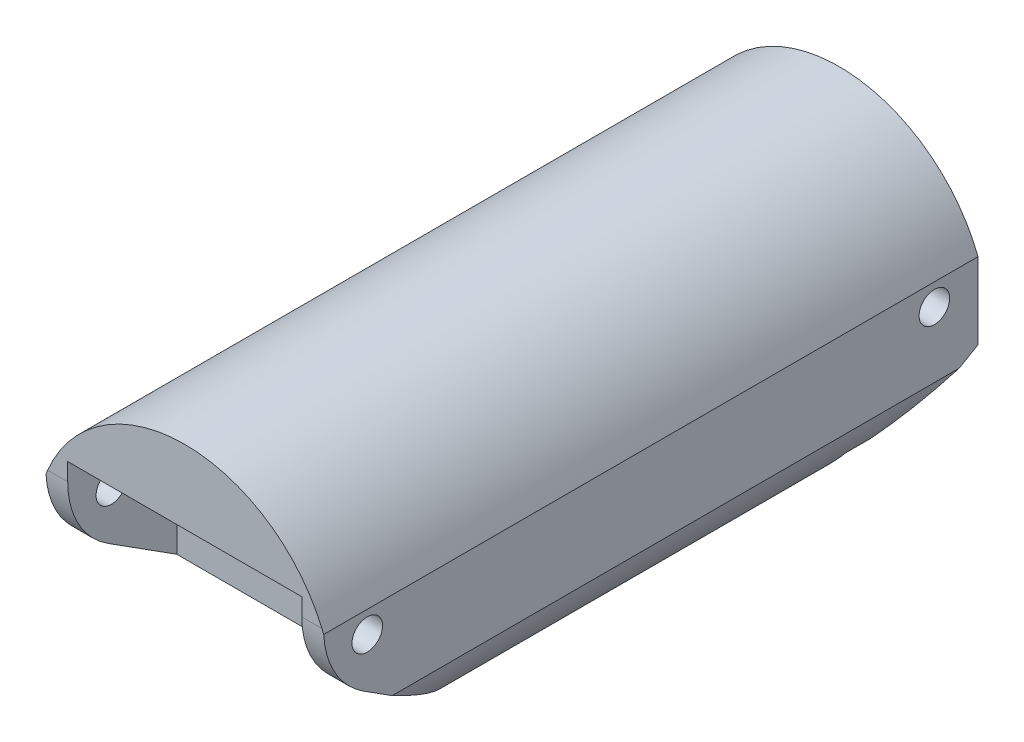
from build123d import *

# Parameters (mm, degrees)
BOSS_EXTRUDE1_DEPTH = 19.05
CUT_EXTRUDE1_DEPTH  = 28.152681872
CUT_EXTRUDE2_DEPTH  = 43.73143612
SKETCH10_R          = 0.889
CUT_EXTRUDE7_DEPTH  = 28.152681872
SKETCH17_W          = 13.630142158
SKETCH17_H          = 6.35
CUT_EXTRUDE14_DEPTH = 12.065
CUT_EXTRUDE15_DEPTH = 17.78
CUT_EXTRUDE16_DEPTH = 17.78
FILLET1_R           = 2.54
FILLET2_R           = 5.08
SKETCH20_W          = 0.284935898
SKETCH20_H          = 2.320192307
CUT_EXTRUDE17_DEPTH = 1
CUT_EXTRUDE18_DEPTH = 17.78


with BuildPart() as part:
    # Sketch1 → Boss-Extrude1 (new, symmetric)
    with BuildSketch(Plane.XY):
        with BuildLine():
            Line((0, 0), (0, 5.08))
            ThreePointArc((0, 5.08), (8.085071079, 10.625071079), (16.170142158, 5.08))
            Line((16.170142158, 5.08), (16.170142158, 0))
            ThreePointArc((16.170142158, 0), (8.085071079, -5.545071079), (0, 0))
        make_face()
    extrude(amount=BOSS_EXTRUDE1_DEPTH, both=True)

    # Sketch2 → Cut-Extrude1 (cut, through all)
    with BuildSketch(Plane(origin=(0, 0, 0), x_dir=(0, 0, -1), z_dir=(1, 0, 0))):
        Polygon((-19.05, -5.545071079), (-19.05, 2.54), (-6.35, -5.545071079), align=None)
        Polygon((19.05, 0.635), (19.05, -5.545071079), (8.345802897, -5.545071079), align=None)
    extrude(amount=CUT_EXTRUDE1_DEPTH, mode=Mode.SUBTRACT)

    # Sketch3 → Cut-Extrude2 (cut, through all)
    with BuildSketch(Plane.XY.offset(19.05)):
        with BuildLine():
            ThreePointArc((5.441540811, -3.786556728), (8.085071079, -4.275071079), (10.728601347, -3.786556728))
            ThreePointArc((10.728601347, -3.786556728), (8.085071079, -2.370071079), (5.441540811, -3.786556728))
        make_face()
    extrude(amount=-CUT_EXTRUDE2_DEPTH, mode=Mode.SUBTRACT)

    # Sketch10 → Cut-Extrude7 (cut, through all)
    with BuildSketch(Plane.ZY):
        with Locations((-16.51, 3.81)):
            Circle(SKETCH10_R)
    cut_extrude7 = extrude(amount=-CUT_EXTRUDE7_DEPTH, mode=Mode.SUBTRACT)

    # Mirror4: Cut-Extrude7 across plane
    add(cut_extrude7.mirror(Plane(origin=(0, 0, 0), x_dir=(1, 0, 0), z_dir=(0, 0, -1))), mode=Mode.SUBTRACT)

    # Sketch17 → Cut-Extrude14 (cut)
    with BuildSketch(Plane(origin=(0, -5.715, 0), x_dir=(1, 0, 0), z_dir=(0, 1, 0))):
        with Locations((8.085071079, -15.875)):
            Rectangle(SKETCH17_W, SKETCH17_H)
        with Locations((8.085071079, 15.875)):
            Rectangle(SKETCH17_W, SKETCH17_H)
    extrude(amount=CUT_EXTRUDE14_DEPTH, mode=Mode.SUBTRACT)

    # Sketch18 → Cut-Extrude15 (cut)
    with BuildSketch(Plane.XY.offset(12.7)):
        with BuildLine():
            Line((10.117071079, 7.4676), (10.752071079, 7.4676))
            ThreePointArc((10.752071079, 7.4676), (11.133071079, 7.8486), (10.752071079, 8.2296))
            Line((10.752071079, 8.2296), (10.117071079, 8.2296))
            ThreePointArc((10.117071079, 8.2296), (9.736071079, 7.8486), (10.117071079, 7.4676))
        make_face()
    extrude(amount=-CUT_EXTRUDE15_DEPTH, mode=Mode.SUBTRACT)

    # Sketch19 → Cut-Extrude16 (cut)
    with BuildSketch(Plane(origin=(0, 0, -12.7), x_dir=(-1, 0, 0), z_dir=(0, 0, -1))):
        with BuildLine():
            Line((-6.053071079, 5.3086), (-5.418071079, 5.3086))
            ThreePointArc((-5.418071079, 5.3086), (-5.037071079, 5.6896), (-5.418071079, 6.0706))
            Line((-5.418071079, 6.0706), (-6.053071079, 6.0706))
            ThreePointArc((-6.053071079, 6.0706), (-6.434071079, 5.6896), (-6.053071079, 5.3086))
        make_face()
    extrude(amount=-CUT_EXTRUDE16_DEPTH, mode=Mode.SUBTRACT)

    # Fillet1
    # the kernel refuses this fillet: 2.54 mm, written as the material it takes off along each edge
    with BuildSketch(Plane(origin=(6.358213123, -3.031174209, -12.7), x_dir=(0, 1, 0), z_dir=(1, 0, 0))) as fillet1_piece_1_section:
        with BuildLine():
            CenterArc((FILLET1_R * 0.57735026919, FILLET1_R), FILLET1_R, 210, 60)
            Line((-FILLET1_R * 0.288675134595, FILLET1_R * 0.5), (0, 0))
            Line((0, 0), (FILLET1_R * 0.57735026919, 0))
        make_face()
    fillet1_piece_1 = extrude(amount=11.496741726, mode=Mode.PRIVATE)
    fillet1_piece_1 = split(fillet1_piece_1, bisect_by=Plane(origin=(14.900142158, -2.770915154, -12.481593897), z_dir=(-1, 0, 0)), keep=Keep.TOP, mode=Mode.PRIVATE)
    add(fillet1_piece_1, mode=Mode.SUBTRACT)
    with BuildSketch(Plane(origin=(-1.684812691, -3.031174209, -12.7), x_dir=(0, 1, 0), z_dir=(1, 0, 0))) as fillet1_piece_2_section:
        with BuildLine():
            CenterArc((FILLET1_R * 0.57735026919, FILLET1_R), FILLET1_R, 210, 60)
            Line((-FILLET1_R * 0.288675134595, FILLET1_R * 0.5), (0, 0))
            Line((0, 0), (FILLET1_R * 0.57735026919, 0))
        make_face()
    fillet1_piece_2 = extrude(amount=11.496741726, mode=Mode.PRIVATE)
    fillet1_piece_2 = split(fillet1_piece_2, bisect_by=Plane(origin=(1.27, -2.770915061, -12.481593186), z_dir=(1, 0, 0)), keep=Keep.TOP, mode=Mode.PRIVATE)
    add(fillet1_piece_2, mode=Mode.SUBTRACT)

    # Fillet2
    fillet2_edges = [part.edges().sort_by_distance(p)[0] for p in [
        (0.635, 2.54, 19.05),
        (15.535142158, 2.54, 19.05),
    ]]
    fillet(fillet2_edges, radius=FILLET2_R)

    # Sketch20 → Cut-Extrude17 (cut)
    # profile 1 of 6: a face of its own
    with BuildSketch(Plane.ZY):
        with BuildLine():
            Line((-6.061862576, 4.037521848), (-5.426480965, 4.037521848))
            add(Edge.make_bspline(
                [(-5.426480965, 4.037521848), (-5.384080084, 4.037380709), (-5.302665696, 4.037109707), (-5.186031372, 4.035598622), (-5.080052506, 4.031267599), (-4.984784509, 4.027540527), (-4.900229129, 4.020744266), (-4.826127086, 4.014248536), (-4.762819675, 4.005745287), (-4.724496653, 3.997848225), (-4.707145028, 3.994272649)],
                knots=[0, 0, 0, 0, 1.410062039, 2.707475311, 3.878576406, 4.937260626, 5.877586885, 6.699081471, 7.410979367, 8, 8, 8, 8], degree=3))
            add(Edge.make_bspline(
                [(-4.707145028, 3.994272649), (-4.683916161, 3.988533369), (-4.637953964, 3.977177243), (-4.571777832, 3.953174605), (-4.50871841, 3.925398232), (-4.449037641, 3.892774), (-4.393034459, 3.855059735), (-4.34013142, 3.81290651), (-4.290088464, 3.766544973), (-4.244929413, 3.714806224), (-4.202348988, 3.660525962), (-4.166436448, 3.601830411), (-4.135478856, 3.54045174), (-4.110831315, 3.475765725), (-4.090984868, 3.408399689), (-4.076991065, 3.337743423), (-4.068598916, 3.264118825), (-4.067744519, 3.213901293), (-4.067311294, 3.188438314)],
                knots=[0, 0, 0, 0, 1.027469482, 2.033020251, 3.019912614, 3.986113645, 4.951240523, 5.91722682, 6.890402269, 7.87763091, 8.8651537, 9.85103654, 10.82876324, 11.815024772, 12.821070561, 13.842952187, 14.906261191, 16, 16, 16, 16], degree=3))
            add(Edge.make_bspline(
                [(-4.067311294, 3.188438314), (-4.068643885, 3.146133612), (-4.071244115, 3.063586181), (-4.095487602, 2.943788096), (-4.135199159, 2.832037789), (-4.189921, 2.728475967), (-4.259607239, 2.635121311), (-4.343359013, 2.553124255), (-4.441223047, 2.484508048), (-4.532326783, 2.436925861), (-4.612803236, 2.406452294), (-4.679054884, 2.38501074), (-4.751324214, 2.368444529), (-4.828918796, 2.353603552), (-4.91216154, 2.342398801), (-5.000852933, 2.334192247), (-5.095056228, 2.329063217), (-5.159770955, 2.328299398), (-5.193062495, 2.327906463)],
                knots=[0, 0, 0, 0, 1.260483769, 2.459530307, 3.627416485, 4.787058657, 5.939039949, 7.08810263, 8.267026773, 9.491475466, 10.141966685, 10.831826277, 11.566392101, 12.351337768, 13.187381173, 14.07005841, 15.007169909, 16, 16, 16, 16], degree=3))
            Line((-5.193062495, 2.327906463), (-4.026606165, 0.862521848))
            Line((-4.026606165, 0.862521848), (-4.378959931, 0.862521848))
            Line((-4.378959931, 0.862521848), (-5.545416262, 2.327906463))
            Line((-5.545416262, 2.327906463), (-5.776926678, 2.327906463))
            Line((-5.776926678, 2.327906463), (-5.776926678, 0.862521848))
            Line((-5.776926678, 0.862521848), (-6.061862576, 0.862521848))
            Line((-6.061862576, 0.862521848), (-6.061862576, 4.037521848))
        make_face()
        with BuildLine():
            Line((-5.776926678, 3.711880822), (-5.776926678, 2.653547489))
            Line((-5.776926678, 2.653547489), (-5.195606566, 2.649095365))
            add(Edge.make_bspline(
                [(-5.195606566, 2.649095365), (-5.168464816, 2.649083358), (-5.115856375, 2.649060084), (-5.039746487, 2.652683009), (-4.968880385, 2.656804448), (-4.903529131, 2.663108497), (-4.843663531, 2.671232934), (-4.789313506, 2.681395641), (-4.740390338, 2.693235726), (-4.683332378, 2.711561487), (-4.61961781, 2.740595518), (-4.550374271, 2.782837077), (-4.491407865, 2.835967635), (-4.441589519, 2.896722128), (-4.40155782, 2.963520725), (-4.373334742, 3.035562717), (-4.355425527, 3.111029381), (-4.353313203, 3.162898093), (-4.352247191, 3.189074332)],
                knots=[0, 0, 0, 0, 1.146690395, 2.22261258, 3.21895312, 4.145990853, 4.996080663, 5.770904154, 6.481378293, 7.121626537, 8.300444488, 9.431385265, 10.535395872, 11.636531494, 12.74115979, 13.810798291, 14.895190096, 16, 16, 16, 16], degree=3))
            add(Edge.make_bspline(
                [(-4.352247191, 3.189074332), (-4.353337687, 3.214607295), (-4.355498651, 3.265204311), (-4.373141462, 3.339277887), (-4.40297683, 3.409188621), (-4.443183431, 3.474652118), (-4.492168379, 3.534075178), (-4.54960668, 3.584917953), (-4.613927822, 3.626872824), (-4.674045266, 3.653682869), (-4.727779159, 3.670120165), (-4.774433208, 3.681687292), (-4.827148619, 3.690980489), (-4.886181357, 3.698426373), (-4.951279408, 3.704826215), (-5.022771927, 3.709136757), (-5.100184578, 3.711689334), (-5.153839294, 3.711815507), (-5.181614178, 3.711880822)],
                knots=[0, 0, 0, 0, 1.101028733, 2.181837193, 3.264309656, 4.369019818, 5.486613113, 6.575447106, 7.666700264, 8.788928104, 9.402425223, 10.0903467, 10.862060571, 11.710948788, 12.657782767, 13.684531032, 14.801375019, 16, 16, 16, 16], degree=3))
            Line((-5.181614178, 3.711880822), (-5.776926678, 3.711880822))
        make_face(mode=Mode.SUBTRACT)
    # profile 2 of 6: a face of its own
    with BuildSketch(Plane.ZY):
        with BuildLine():
            add(Edge.make_bspline(
                [(-3.356243585, 4.159637232), (-3.338562177, 4.158817037), (-3.303938585, 4.157210937), (-3.253870406, 4.143457311), (-3.208280117, 4.120144025), (-3.167841745, 4.088866029), (-3.133141819, 4.052081891), (-3.108847889, 4.009209441), (-3.093233787, 3.962891962), (-3.09134824, 3.930583988), (-3.090388217, 3.914134428)],
                knots=[0, 0, 0, 0, 1.055194115, 2.066272739, 3.074728998, 4.095836921, 5.109056067, 6.073838105, 7.019297344, 8, 8, 8, 8], degree=3))
            add(Edge.make_bspline(
                [(-3.090388217, 3.914134428), (-3.09136989, 3.898111878), (-3.093310543, 3.866437194), (-3.108835828, 3.820922687), (-3.133348858, 3.778645944), (-3.167819494, 3.741933228), (-3.208286013, 3.710672523), (-3.25386884, 3.687354653), (-3.303938997, 3.673602242), (-3.338562317, 3.671995975), (-3.356243585, 3.671175694)],
                knots=[0, 0, 0, 0, 0.96129708, 1.900370562, 2.859976407, 3.87933698, 4.906634145, 5.921202961, 6.938410037, 8, 8, 8, 8], degree=3))
            add(Edge.make_bspline(
                [(-3.356243585, 3.671175694), (-3.373722663, 3.671964654), (-3.407743405, 3.673500263), (-3.457061898, 3.687624493), (-3.502263456, 3.710680502), (-3.542780695, 3.741728542), (-3.576553799, 3.778871413), (-3.601135851, 3.820896886), (-3.616625281, 3.866443762), (-3.618570765, 3.898114085), (-3.619554883, 3.914134428)],
                knots=[0, 0, 0, 0, 1.054934014, 2.053291228, 3.073705704, 4.106921865, 5.123545215, 6.088680038, 7.033164197, 8, 8, 8, 8], degree=3))
            add(Edge.make_bspline(
                [(-3.619554883, 3.914134428), (-3.618592326, 3.930581699), (-3.616701803, 3.962885176), (-3.601124241, 4.00923567), (-3.576758558, 4.051854604), (-3.542758332, 4.089070593), (-3.502269408, 4.120136094), (-3.45706036, 4.143187485), (-3.407743812, 4.157312914), (-3.373722801, 4.158848357), (-3.356243585, 4.159637232)],
                knots=[0, 0, 0, 0, 0.98631895, 1.937192651, 2.907499808, 3.917963147, 4.944918757, 5.95915025, 6.951458133, 8, 8, 8, 8], degree=3))
        make_face()
    # profile 3 of 6: a face of its own
    with BuildSketch(Plane.ZY):
        with Locations((-3.35497155, 2.022618002)):
            Rectangle(SKETCH20_W, SKETCH20_H)
    # profile 4 of 6: a face of its own
    with BuildSketch(Plane.ZY):
        with BuildLine():
            Line((-2.520516422, 3.182714155), (-2.235580524, 3.182714155))
            Line((-2.235580524, 3.182714155), (-2.235580524, 2.764214556))
            add(Edge.make_bspline(
                [(-2.235580524, 2.764214556), (-2.205157098, 2.802171883), (-2.146119378, 2.875829401), (-2.047799305, 2.972640208), (-1.943891624, 3.05241909), (-1.835032663, 3.116013246), (-1.721074647, 3.163952686), (-1.602712216, 3.198574638), (-1.479236733, 3.219334446), (-1.395267565, 3.222047012), (-1.352788056, 3.223419284)],
                knots=[0, 0, 0, 0, 1.12780773, 2.188550248, 3.19190651, 4.159438251, 5.104880172, 6.052711206, 7.014878035, 8, 8, 8, 8], degree=3))
            add(Edge.make_bspline(
                [(-1.352788056, 3.223419284), (-1.30985241, 3.221836142), (-1.225816993, 3.218737552), (-1.103463323, 3.194229554), (-0.989187458, 3.152369215), (-0.883396861, 3.095026837), (-0.788031461, 3.023719536), (-0.704279631, 2.940645406), (-0.635007257, 2.84509053), (-0.588563934, 2.756441667), (-0.557969954, 2.677802546), (-0.538709191, 2.610450137), (-0.522352515, 2.535412957), (-0.508172286, 2.452917759), (-0.498577335, 2.362386543), (-0.491009684, 2.264190423), (-0.485586155, 2.158361204), (-0.485370974, 2.085166906), (-0.485260012, 2.047422689)],
                knots=[0, 0, 0, 0, 1.235846778, 2.418850247, 3.575807741, 4.728682307, 5.871620074, 6.994088408, 8.11269785, 9.256955736, 9.865816715, 10.540099792, 11.271859618, 12.076849838, 12.949306005, 13.892391288, 14.913166135, 16, 16, 16, 16], degree=3))
            Line((-0.485260012, 2.047422689), (-0.485260012, 0.862521848))
            Line((-0.485260012, 0.862521848), (-0.770195909, 0.862521848))
            Line((-0.770195909, 0.862521848), (-0.770195909, 1.953928098))
            add(Edge.make_bspline(
                [(-0.770195909, 1.953928098), (-0.770371176, 1.98551703), (-0.770706433, 2.045941281), (-0.771763841, 2.132454609), (-0.774312737, 2.210910291), (-0.777894421, 2.28112076), (-0.783136827, 2.343018598), (-0.788600214, 2.39672987), (-0.7952813, 2.442186384), (-0.8012348, 2.469550423), (-0.803904843, 2.481822729)],
                knots=[0, 0, 0, 0, 1.430800155, 2.736877192, 3.918605307, 4.986035426, 5.920637409, 6.731861385, 7.431261377, 8, 8, 8, 8], degree=3))
            add(Edge.make_bspline(
                [(-0.803904843, 2.481822729), (-0.813543718, 2.517846447), (-0.83209557, 2.587180958), (-0.877937112, 2.681228407), (-0.935825691, 2.761236763), (-1.006490168, 2.82671136), (-1.089247973, 2.877666333), (-1.183869452, 2.913021278), (-1.289441505, 2.935134037), (-1.363695123, 2.937335792), (-1.402397431, 2.938483386)],
                knots=[0, 0, 0, 0, 1.084156227, 2.086665306, 3.027808233, 3.945421172, 4.874247719, 5.839848303, 6.874090471, 8, 8, 8, 8], degree=3))
            add(Edge.make_bspline(
                [(-1.402397431, 2.938483386), (-1.42531883, 2.938051582), (-1.470679686, 2.937197053), (-1.537944303, 2.928623375), (-1.603189803, 2.914600347), (-1.667070993, 2.895669512), (-1.728310206, 2.869668739), (-1.788874956, 2.840159953), (-1.846484663, 2.803376932), (-1.902367745, 2.762382583), (-1.954358649, 2.716953588), (-2.00273507, 2.669016068), (-2.045858846, 2.617966056), (-2.084928287, 2.564626104), (-2.118654283, 2.508263651), (-2.14809387, 2.449422458), (-2.173072679, 2.38802508), (-2.185484835, 2.345411989), (-2.191695308, 2.324090357)],
                knots=[0, 0, 0, 0, 1.023777757, 2.026029729, 3.023749952, 4.003683103, 4.997618607, 5.993177895, 7.010360494, 8.046726602, 9.087585522, 10.09234134, 11.086953743, 12.070360549, 13.043493632, 14.017870808, 15.008233677, 16, 16, 16, 16], degree=3))
            add(Edge.make_bspline(
                [(-2.191695308, 2.324090357), (-2.195269132, 2.308437423), (-2.20304916, 2.274361804), (-2.211452188, 2.218441509), (-2.21907906, 2.153753175), (-2.225462586, 2.080372287), (-2.229368214, 1.998041929), (-2.233626703, 1.907113705), (-2.235177065, 1.807225041), (-2.235442272, 1.737681934), (-2.235580524, 1.701429099)],
                knots=[0, 0, 0, 0, 0.615963638, 1.340920617, 2.168419149, 3.115676021, 4.16674242, 5.331190069, 6.6087489, 8, 8, 8, 8], degree=3))
            Line((-2.235580524, 1.701429099), (-2.235580524, 0.862521848))
            Line((-2.235580524, 0.862521848), (-2.520516422, 0.862521848))
            Line((-2.520516422, 0.862521848), (-2.520516422, 3.182714155))
        make_face()
    # profile 5 of 6: a face of its own
    with BuildSketch(Plane.ZY):
        with BuildLine():
            Line((2.20127845, 3.182714155), (2.486214347, 3.182714155))
            Line((2.486214347, 3.182714155), (2.486214347, 1.341443122))
            add(Edge.make_bspline(
                [(2.486214347, 1.341443122), (2.48596303, 1.302220447), (2.485477928, 1.226511236), (2.481984546, 1.117038796), (2.474617932, 1.015923133), (2.466264343, 0.922703084), (2.454247679, 0.837810741), (2.439573403, 0.760992791), (2.423031036, 0.692175517), (2.408498411, 0.649789411), (2.401624003, 0.629739396)],
                knots=[0, 0, 0, 0, 1.307562039, 2.523909702, 3.650326591, 4.686913197, 5.643429486, 6.506965704, 7.293745905, 8, 8, 8, 8], degree=3))
            add(Edge.make_bspline(
                [(2.401624003, 0.629739396), (2.391473765, 0.603677253), (2.371476774, 0.552332208), (2.334024807, 0.479548217), (2.292084052, 0.411016849), (2.244180785, 0.347120018), (2.190531627, 0.28817849), (2.132400559, 0.232911719), (2.068655457, 0.182488939), (1.999332768, 0.137780133), (1.926030515, 0.097514734), (1.848790837, 0.062638206), (1.768049282, 0.032260855), (1.683047373, 0.009507176), (1.595117803, -0.010209321), (1.503226562, -0.023040572), (1.407910525, -0.031773689), (1.343099359, -0.032581257), (1.310217753, -0.032990973)],
                knots=[0, 0, 0, 0, 0.981931301, 1.934503488, 2.87077864, 3.801706999, 4.735015492, 5.667491629, 6.616593066, 7.585388521, 8.561939025, 9.551802639, 10.560317337, 11.588439944, 12.640189604, 13.723962949, 14.845264515, 16, 16, 16, 16], degree=3))
            add(Edge.make_bspline(
                [(1.310217753, -0.032990973), (1.262243744, -0.032214018), (1.168537614, -0.030696416), (1.031917371, -0.013015372), (0.902164447, 0.011980381), (0.780993332, 0.049813162), (0.669169744, 0.096111003), (0.567457372, 0.149264996), (0.476769295, 0.210215297), (0.395014249, 0.279612271), (0.321225807, 0.362129325), (0.251804622, 0.459373991), (0.184983625, 0.572827526), (0.145823504, 0.65609663), (0.125316912, 0.699701335)],
                knots=[0, 0, 0, 0, 1.157897085, 2.2616841, 3.32207898, 4.345638746, 5.321241055, 6.241986252, 7.112515963, 7.955008012, 8.825025602, 9.77857164, 10.836726669, 12, 12, 12, 12], degree=3))
            Line((0.125316912, 0.699701335), (0.410252809, 0.699701335))
            add(Edge.make_bspline(
                [(0.410252809, 0.699701335), (0.433169242, 0.663319576), (0.477968046, 0.592197718), (0.561741311, 0.500110784), (0.653549907, 0.421413088), (0.756492191, 0.357994029), (0.870996493, 0.310178718), (0.997131701, 0.276092557), (1.135924215, 0.255685229), (1.232551453, 0.253225698), (1.282868995, 0.251944925)],
                knots=[0, 0, 0, 0, 0.997731894, 1.950442991, 2.880492273, 3.800895997, 4.748200782, 5.754801363, 6.83083817, 8, 8, 8, 8], degree=3))
            add(Edge.make_bspline(
                [(1.282868995, 0.251944925), (1.332550388, 0.253242274), (1.428331142, 0.255743433), (1.566063702, 0.276101664), (1.69178911, 0.310186136), (1.804783007, 0.357909458), (1.903712168, 0.416375184), (1.988994475, 0.481689537), (2.058068574, 0.555332304), (2.104526051, 0.623170085), (2.133404596, 0.683607689), (2.151794411, 0.735634687), (2.166738655, 0.794465511), (2.179238936, 0.859902929), (2.189553979, 0.932040432), (2.196088022, 1.011042963), (2.200810437, 1.096730971), (2.201118838, 1.156142604), (2.20127845, 1.186890838)],
                knots=[0, 0, 0, 0, 1.570740765, 3.028230971, 4.391408896, 5.680370741, 6.894727393, 8.017376726, 9.065722033, 10.075533815, 10.603371122, 11.180248986, 11.817768598, 12.521299649, 13.286540596, 14.121245857, 15.027658897, 16, 16, 16, 16], degree=3))
            Line((2.20127845, 1.186890838), (2.20127845, 1.30709817))
            add(Edge.make_bspline(
                [(2.20127845, 1.30709817), (2.172357722, 1.272679535), (2.115024973, 1.204447679), (2.016012755, 1.115038194), (1.907865981, 1.038034347), (1.790768768, 0.9748803), (1.667589434, 0.924369293), (1.539662125, 0.889042465), (1.408133618, 0.866218841), (1.319004882, 0.863762919), (1.273964748, 0.862521848)],
                knots=[0, 0, 0, 0, 1.012485704, 2.007162095, 2.997754123, 3.998611389, 4.999708251, 5.992315798, 6.98544096, 8, 8, 8, 8], degree=3))
            add(Edge.make_bspline(
                [(1.273964748, 0.862521848), (1.247443275, 0.86298905), (1.194714184, 0.863917927), (1.116378091, 0.872044818), (1.03919798, 0.883836534), (0.963353848, 0.901146125), (0.888736257, 0.92336362), (0.815468512, 0.951137375), (0.742957385, 0.982538233), (0.672520919, 1.01952499), (0.604860643, 1.060675083), (0.540486896, 1.105251077), (0.479736865, 1.153019667), (0.423188763, 1.204451891), (0.370916769, 1.25947331), (0.322217831, 1.31749739), (0.277897238, 1.379334362), (0.23704552, 1.443856674), (0.201614743, 1.511494083), (0.17051392, 1.580779927), (0.143472531, 1.651566057), (0.121913916, 1.724089464), (0.105448263, 1.798304426), (0.093192558, 1.874089361), (0.086241184, 1.951677642), (0.085157217, 2.003948437), (0.084611783, 2.030250213)],
                knots=[0, 0, 0, 0, 1.028754217, 2.045334182, 3.052854819, 4.056607503, 5.061168794, 6.071104265, 7.095078842, 8.125279047, 9.155117945, 10.165957491, 11.161587969, 12.151493252, 13.128948131, 14.104219989, 15.088194871, 16.07871515, 17.064853787, 18.047899887, 19.02414258, 20.002704429, 20.980574569, 21.971845993, 22.979467364, 24, 24, 24, 24], degree=3))
            add(Edge.make_bspline(
                [(0.084611783, 2.030250213), (0.085082741, 2.056560164), (0.086022833, 2.109078165), (0.09414265, 2.186983036), (0.105725222, 2.263844738), (0.124056555, 2.338871024), (0.146120558, 2.412916334), (0.173446942, 2.485433748), (0.20630253, 2.556445353), (0.243504232, 2.626003735), (0.285309087, 2.6931755), (0.331149266, 2.756971814), (0.381080109, 2.816923228), (0.434412776, 2.873634553), (0.491798467, 2.926558622), (0.553207496, 2.975566983), (0.618034537, 3.021481135), (0.686480507, 3.063310705), (0.757489281, 3.100306029), (0.829256815, 3.134063171), (0.902733786, 3.160854836), (0.976550304, 3.184461505), (1.052006369, 3.20118486), (1.12817679, 3.214086465), (1.20532234, 3.221946605), (1.256986752, 3.222927757), (1.282868995, 3.223419284)],
                knots=[0, 0, 0, 0, 1.008818848, 2.013730394, 3.001654427, 3.987803273, 4.973046549, 5.963777569, 6.957074694, 7.972068341, 8.987420212, 9.989399531, 10.982630087, 11.977756091, 12.973280677, 13.973972381, 14.989194003, 16.018387222, 17.047741039, 18.059210846, 19.057554164, 20.045176975, 21.029480261, 22.018708529, 23.007435371, 24, 24, 24, 24], degree=3))
            add(Edge.make_bspline(
                [(1.282868995, 3.223419284), (1.325550918, 3.222188587), (1.409834602, 3.21975834), (1.533869154, 3.200689158), (1.653559614, 3.17028716), (1.769581386, 3.126730124), (1.882879584, 3.067266875), (1.993080799, 2.988941486), (2.100503871, 2.891051392), (2.166795903, 2.815982722), (2.20127845, 2.776934909)],
                knots=[0, 0, 0, 0, 0.96728863, 1.910097829, 2.838038873, 3.762875196, 4.71315279, 5.730631239, 6.819562287, 8, 8, 8, 8], degree=3))
            Line((2.20127845, 2.776934909), (2.20127845, 3.182714155))
        make_face()
        with BuildLine():
            add(Edge.make_bspline(
                [(1.30576563, 2.938483386), (1.26409992, 2.937067277), (1.181610649, 2.93426368), (1.060699081, 2.910328976), (0.94397072, 2.872822338), (0.833657224, 2.819171537), (0.730327203, 2.753771764), (0.638637902, 2.674541646), (0.558442014, 2.584057596), (0.490603205, 2.483137729), (0.436599751, 2.374260379), (0.398369649, 2.259497071), (0.373649986, 2.140702184), (0.370921615, 2.059628466), (0.369547681, 2.018801896)],
                knots=[0, 0, 0, 0, 1.026226791, 2.031711442, 3.026614839, 4.04107745, 5.047145931, 6.032893242, 7.017642609, 8.019221815, 9.021877557, 10.003543541, 10.994637589, 12, 12, 12, 12], degree=3))
            add(Edge.make_bspline(
                [(0.369547681, 2.018801896), (0.370206046, 1.98801957), (0.371500858, 1.927479737), (0.383950103, 1.838636075), (0.404071407, 1.754017505), (0.432589444, 1.673618908), (0.467925103, 1.59697913), (0.512368183, 1.52462611), (0.56466585, 1.456495412), (0.624408771, 1.393090951), (0.690245917, 1.335341358), (0.761655476, 1.284597564), (0.838540596, 1.243095124), (0.919010345, 1.207225936), (1.005017245, 1.181028496), (1.095322488, 1.161036175), (1.190564955, 1.14959823), (1.255490747, 1.14818055), (1.288593154, 1.147457745)],
                knots=[0, 0, 0, 0, 1.039728707, 2.044842319, 3.024901384, 3.974314358, 4.923051295, 5.871625912, 6.837440708, 7.820715446, 8.810779094, 9.792721783, 10.773906224, 11.758876063, 12.764959493, 13.806266761, 14.881525401, 16, 16, 16, 16], degree=3))
            add(Edge.make_bspline(
                [(1.288593154, 1.147457745), (1.322124563, 1.148154076), (1.387694878, 1.149515744), (1.483462799, 1.161221061), (1.574206785, 1.180109568), (1.659843631, 1.206927455), (1.740696676, 1.241146472), (1.815857648, 1.284450403), (1.88693814, 1.33376671), (1.951668597, 1.391290465), (2.010201233, 1.454686139), (2.061210572, 1.523669723), (2.104675822, 1.597203193), (2.140669137, 1.675278263), (2.168147586, 1.758501683), (2.186579736, 1.846665406), (2.199467283, 1.939347048), (2.200665551, 2.002854864), (2.20127845, 2.035338354)],
                knots=[0, 0, 0, 0, 1.121943988, 2.193949579, 3.223793937, 4.220241907, 5.192961521, 6.155822191, 7.11847367, 8.083710714, 9.04790392, 10.001595906, 10.949595423, 11.902125208, 12.873731292, 13.87582262, 14.913508608, 16, 16, 16, 16], degree=3))
            add(Edge.make_bspline(
                [(2.20127845, 2.035338354), (2.20006327, 2.077627407), (2.197689236, 2.160245357), (2.175285386, 2.280629354), (2.139162767, 2.393812365), (2.088501784, 2.499436429), (2.025018105, 2.596382377), (1.948554264, 2.682854722), (1.860428936, 2.758964785), (1.760895316, 2.822372432), (1.65380942, 2.873594647), (1.541758049, 2.912022826), (1.424907559, 2.933789098), (1.345708173, 2.936909618), (1.30576563, 2.938483386)],
                knots=[0, 0, 0, 0, 1.070913519, 2.092188694, 3.091357305, 4.074328408, 5.051968682, 6.018948707, 6.99050112, 7.9935919, 9.000589572, 9.992915277, 10.987769056, 12, 12, 12, 12], degree=3))
        make_face(mode=Mode.SUBTRACT)
    # profile 6 of 6: a face of its own
    with BuildSketch(Plane.ZY):
        with BuildLine():
            Line((4.562175886, 3.060598771), (4.277239988, 3.060598771))
            add(Edge.make_bspline(
                [(4.277239988, 3.060598771), (4.279097049, 3.098400219), (4.282744266, 3.172641257), (4.299824214, 3.280885087), (4.324263438, 3.384349083), (4.358817828, 3.482202504), (4.40173138, 3.575310565), (4.45319362, 3.663303437), (4.514148041, 3.745845444), (4.583278436, 3.822171394), (4.658361415, 3.892191548), (4.73937466, 3.952657375), (4.824505507, 4.003745549), (4.913495676, 4.046454961), (5.007349187, 4.07851325), (5.105214351, 4.102300023), (5.207521139, 4.116611422), (5.277226016, 4.118149742), (5.312676687, 4.118932104)],
                knots=[0, 0, 0, 0, 1.10065271, 2.161652631, 3.183658789, 4.190468796, 5.17591951, 6.163126047, 7.15150782, 8.156236427, 9.156009102, 10.134482811, 11.092018607, 12.041330605, 13.001268258, 13.972401359, 14.968799086, 16, 16, 16, 16], degree=3))
            add(Edge.make_bspline(
                [(5.312676687, 4.118932104), (5.347491083, 4.118117076), (5.415900127, 4.116515574), (5.515742097, 4.102762355), (5.610790072, 4.081221711), (5.70085826, 4.050999869), (5.785228047, 4.010373996), (5.864533237, 3.961571943), (5.939717973, 3.905129667), (6.007396984, 3.838677993), (6.069543598, 3.767737259), (6.123157787, 3.692001803), (6.169071157, 3.613779523), (6.207341409, 3.53247394), (6.235513764, 3.447319507), (6.256902567, 3.359555973), (6.268992435, 3.268274895), (6.270847926, 3.206492519), (6.271791271, 3.175081944)],
                knots=[0, 0, 0, 0, 1.111607364, 2.184268762, 3.212621178, 4.221274766, 5.211760367, 6.196651075, 7.1921475, 8.207485113, 9.220403448, 10.201281604, 11.166441695, 12.114753415, 13.065576456, 14.026450734, 14.996634279, 16, 16, 16, 16], degree=3))
            add(Edge.make_bspline(
                [(6.271791271, 3.175081944), (6.270255239, 3.130860694), (6.267210132, 3.043194214), (6.24116209, 2.914366446), (6.200479898, 2.789549559), (6.151496581, 2.689095006), (6.102082293, 2.60814748), (6.057552911, 2.541500869), (6.005424118, 2.469740908), (5.944937195, 2.393107895), (5.877343375, 2.311001574), (5.802030413, 2.223471545), (5.718461254, 2.131422154), (5.659806757, 2.068552073), (5.629413466, 2.035974372)],
                knots=[0, 0, 0, 0, 1.184426356, 2.348067706, 3.509069118, 4.696110526, 5.333549288, 6.050745305, 6.844228056, 7.710549037, 8.667450064, 9.695053472, 10.805634456, 12, 12, 12, 12], degree=3))
            Line((5.629413466, 2.035974372), (4.835027448, 1.188162873))
            Line((4.835027448, 1.188162873), (6.312496399, 1.188162873))
            Line((6.312496399, 1.188162873), (6.312496399, 0.862521848))
            Line((6.312496399, 0.862521848), (4.155124604, 0.862521848))
            Line((4.155124604, 0.862521848), (5.386454732, 2.176534268))
            add(Edge.make_bspline(
                [(5.386454732, 2.176534268), (5.416433887, 2.20782916), (5.474017707, 2.267940243), (5.55546333, 2.355699929), (5.628614412, 2.437115584), (5.693944476, 2.512033381), (5.750036299, 2.58154916), (5.799813252, 2.643411499), (5.839696324, 2.70033875), (5.882981004, 2.766324878), (5.924903687, 2.846890338), (5.960928467, 2.945345899), (5.982894794, 3.046698478), (5.985529895, 3.115189611), (5.986855373, 3.149641239)],
                knots=[0, 0, 0, 0, 1.329631726, 2.553950428, 3.673215718, 4.687767853, 5.603093632, 6.413772471, 7.123043292, 7.734684054, 8.834405432, 9.900288307, 10.943827018, 12, 12, 12, 12], degree=3))
            add(Edge.make_bspline(
                [(5.986855373, 3.149641239), (5.986278664, 3.171305079), (5.985142081, 3.214000347), (5.97511117, 3.276598429), (5.959952354, 3.336982224), (5.938230584, 3.395337471), (5.909558755, 3.451077456), (5.874657904, 3.504270027), (5.834389775, 3.555695017), (5.787806837, 3.603912652), (5.73663353, 3.648073459), (5.682573032, 3.687193165), (5.625377581, 3.719885787), (5.565288327, 3.74668596), (5.502472794, 3.767709341), (5.436809489, 3.782276767), (5.368479846, 3.79142302), (5.321822318, 3.792660519), (5.298048282, 3.793291078)],
                knots=[0, 0, 0, 0, 0.991446411, 1.95395049, 2.89581595, 3.838931463, 4.798493298, 5.75982156, 6.748411868, 7.785213223, 8.824556874, 9.840280684, 10.836137867, 11.835679398, 12.848801643, 13.863922112, 14.911575587, 16, 16, 16, 16], degree=3))
            add(Edge.make_bspline(
                [(5.298048282, 3.793291078), (5.273219026, 3.792642442), (5.224458468, 3.791368627), (5.152867631, 3.782458068), (5.084572676, 3.76708577), (5.019401807, 3.746061215), (4.957244754, 3.719338103), (4.8984038, 3.686053449), (4.843011036, 3.646335566), (4.790962333, 3.60130449), (4.743007152, 3.55116888), (4.7008732, 3.495279842), (4.664057701, 3.43465783), (4.631936468, 3.369466416), (4.605850949, 3.299114058), (4.585918163, 3.223850497), (4.570145809, 3.14400253), (4.564876651, 3.088861774), (4.562175886, 3.060598771)],
                knots=[0, 0, 0, 0, 1.031018746, 2.02475058, 2.990194455, 3.934040569, 4.864654155, 5.795059489, 6.735614925, 7.690564532, 8.649604399, 9.611025574, 10.590972636, 11.591080095, 12.624614302, 13.701020113, 14.821632451, 16, 16, 16, 16], degree=3))
        make_face()
    extrude(amount=-CUT_EXTRUDE17_DEPTH, mode=Mode.SUBTRACT)

    # Sketch21 → Cut-Extrude18 (cut)
    with BuildSketch(Plane.XY.offset(12.7)):
        with BuildLine():
            Line((10.752071079, 6.0706), (10.117071079, 6.0706))
            ThreePointArc((10.117071079, 6.0706), (9.736071079, 5.6896), (10.117071079, 5.3086))
            Line((10.117071079, 5.3086), (10.752071079, 5.3086))
            Line((10.752071079, 5.3086), (10.752071079, 6.0706))
        make_face()
        with BuildLine():
            ThreePointArc((10.752071079, 5.3086), (11.133071079, 5.6896), (10.752071079, 6.0706))
            Line((10.752071079, 6.0706), (10.752071079, 5.3086))
        make_face()
    extrude(amount=-CUT_EXTRUDE18_DEPTH, mode=Mode.SUBTRACT)


solid = part.part
